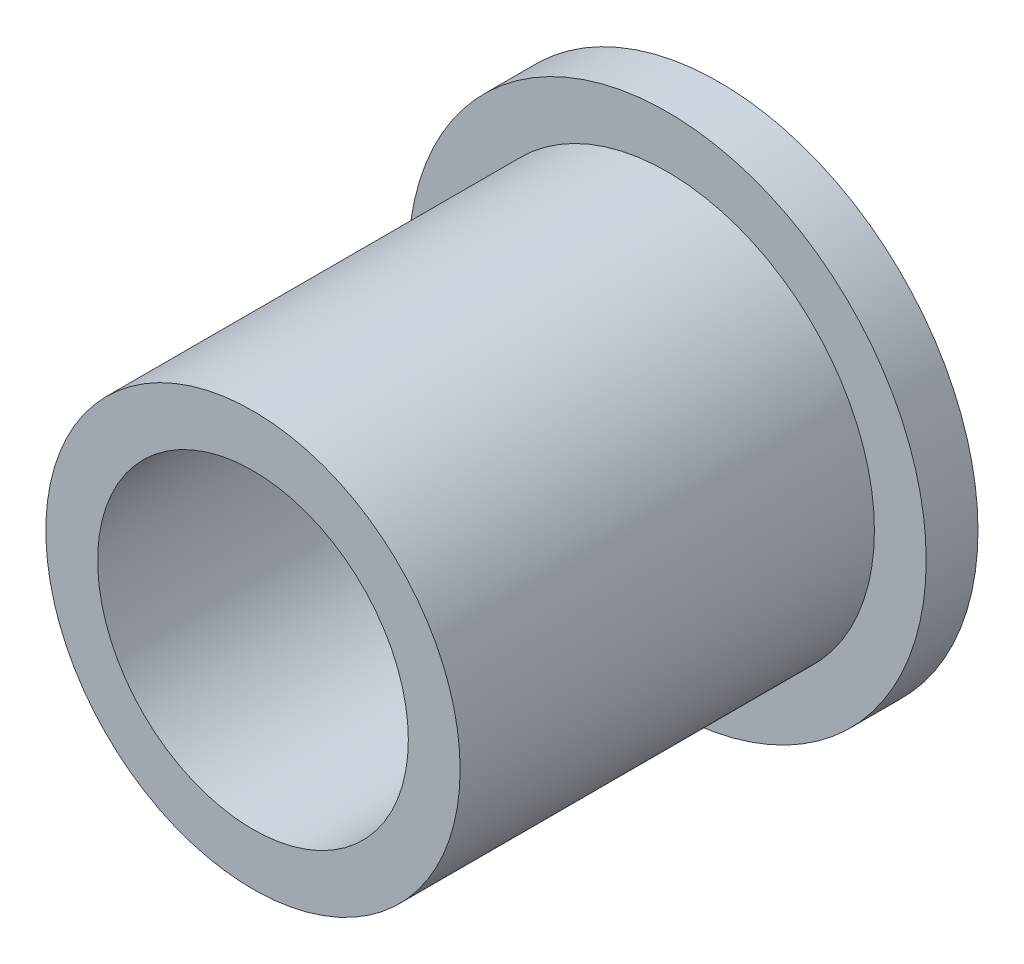
from build123d import *

# Parameters (mm, degrees)
SKETCH_1_R      = 7.9375
SKETCH_1_R_2    = 4.7625
EXTRUDE_1_DEPTH = 1.5875
EXTRUDE_START   = 12.7
SKETCH_1_3_R    = 6.35
SKETCH_1_3_R_2  = 4.7625
EXTRUDE_2_DEPTH = 12.7


with BuildPart() as part:
    # 草图1 → 凸台-拉伸1 (new body)
    with BuildSketch(Plane.XY):
        Circle(SKETCH_1_R)
        Circle(SKETCH_1_R_2, mode=Mode.SUBTRACT)
    extrude(amount=-EXTRUDE_1_DEPTH)

    # 草图1<3> → 凸台-拉伸2 (add)
    with BuildSketch(Plane.XY.offset(EXTRUDE_START)):
        Circle(SKETCH_1_3_R)
        Circle(SKETCH_1_3_R_2, mode=Mode.SUBTRACT)
    extrude(amount=-EXTRUDE_2_DEPTH)


solid = part.part
